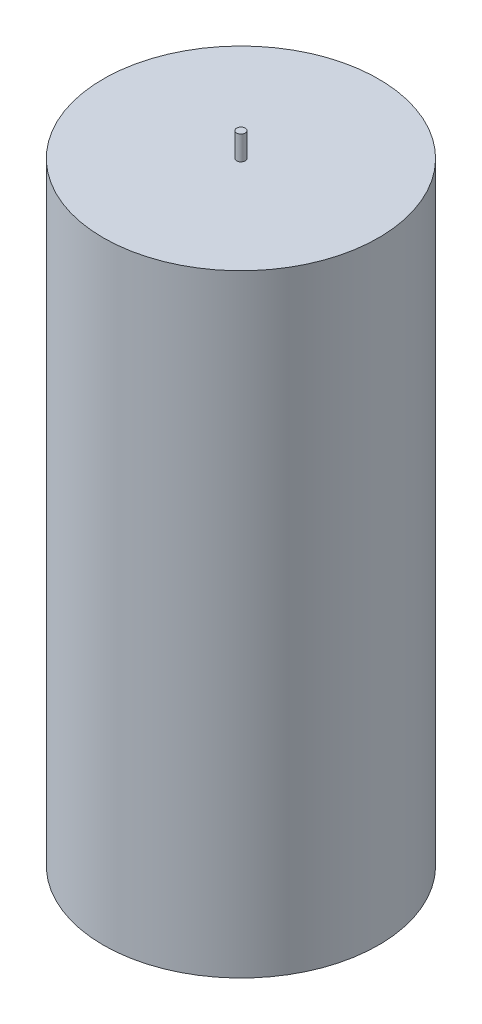
from build123d import *


with BuildPart() as part:
    # Croquis1 → Revolución1 (revolve)
    with BuildSketch(Plane.XY):
        Polygon((2.5, 192), (0, 192), (0, -192), (2.5, -192), (2.5, -178), (80, -178), (80, 178), (2.5, 178), align=None)
    revolve(axis=Axis((0, 415.25313391, 0), (0, -1, 0)))


solid = part.part
